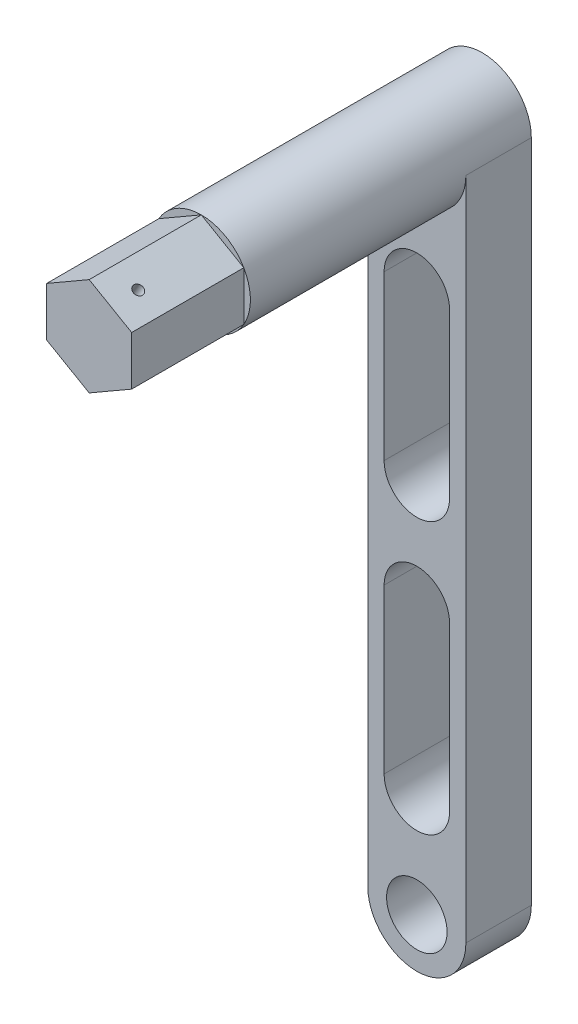
from build123d import *

# Parameters (mm, degrees)
SKETCH1_R               = 4.625
BOSS_EXTRUDE1_DEPTH     = 10
BOSS_EXTRUDE2_DEPTH     = 42.94
BOSS_EXTRUDE3_DEPTH     = 17.14
CUT_EXTRUDE1_DEPTH      = 123.845099649
CUT_EXTRUDE1_DEPTH_BACK = 123.845099649
SKETCH4_R               = 0.75


with BuildPart() as part:
    # Sketch1 → Boss-Extrude1 (new body)
    with BuildSketch(Plane.XY):
        with BuildLine():
            Line((-7.5, 50.8), (-7.5, -50.8))
            ThreePointArc((-7.5, -50.8), (0, -58.3), (7.5, -50.8))
            Line((7.5, -50.8), (7.5, 50.8))
            ThreePointArc((7.5, 50.8), (0, 43.3), (-7.5, 50.8))
        make_face()
        with Locations((0, -50.8)):
            Circle(SKETCH1_R, mode=Mode.SUBTRACT)
        with BuildLine():
            ThreePointArc((5, -34.675), (0, -39.675), (-5, -34.675))
            Line((-5, -34.675), (-5, -9.675))
            ThreePointArc((-5, -9.675), (0, -4.675), (5, -9.675))
            Line((5, -9.675), (5, -34.675))
        make_face(mode=Mode.SUBTRACT)
        with BuildLine():
            ThreePointArc((-5, 31.8), (0, 36.8), (5, 31.8))
            Line((5, 31.8), (5, 6.8))
            ThreePointArc((5, 6.8), (0, 1.8), (-5, 6.8))
            Line((-5, 6.8), (-5, 31.8))
        make_face(mode=Mode.SUBTRACT)
    extrude(amount=BOSS_EXTRUDE1_DEPTH)

    # Sketch1<4> → Boss-Extrude2 (add)
    with BuildSketch(Plane.XY):
        with BuildLine():
            ThreePointArc((7.5, 50.8), (0, 58.3), (-7.5, 50.8))
            ThreePointArc((-7.5, 50.8), (0, 43.3), (7.5, 50.8))
        make_face()
    extrude(amount=BOSS_EXTRUDE2_DEPTH)

    # Sketch3 → Boss-Extrude3 (add)
    with BuildSketch(Plane.XY.offset(42.94)):
        Polygon((0, 43.3), (6.495190528, 47.05), (6.495190528, 54.55), (0, 58.3), (-6.495190528, 54.55), (-6.495190528, 47.05), align=None)
    extrude(amount=BOSS_EXTRUDE3_DEPTH)

    # Sketch4 → Cut-Extrude1 (cut, two sides: drawn at the far end of the back side and taken through both)
    with BuildSketch(Plane(origin=(25.24464052, 43.725, 0), x_dir=(0.8660254037844416, -0.499999999999995, 0), z_dir=(0.49999999999999495, 0.8660254037844415, 0)).offset(-CUT_EXTRUDE1_DEPTH_BACK)):
        with Locations((-25.4, -55.83)):
            Circle(SKETCH4_R)
    extrude(amount=CUT_EXTRUDE1_DEPTH + CUT_EXTRUDE1_DEPTH_BACK, mode=Mode.SUBTRACT)


solid = part.part
